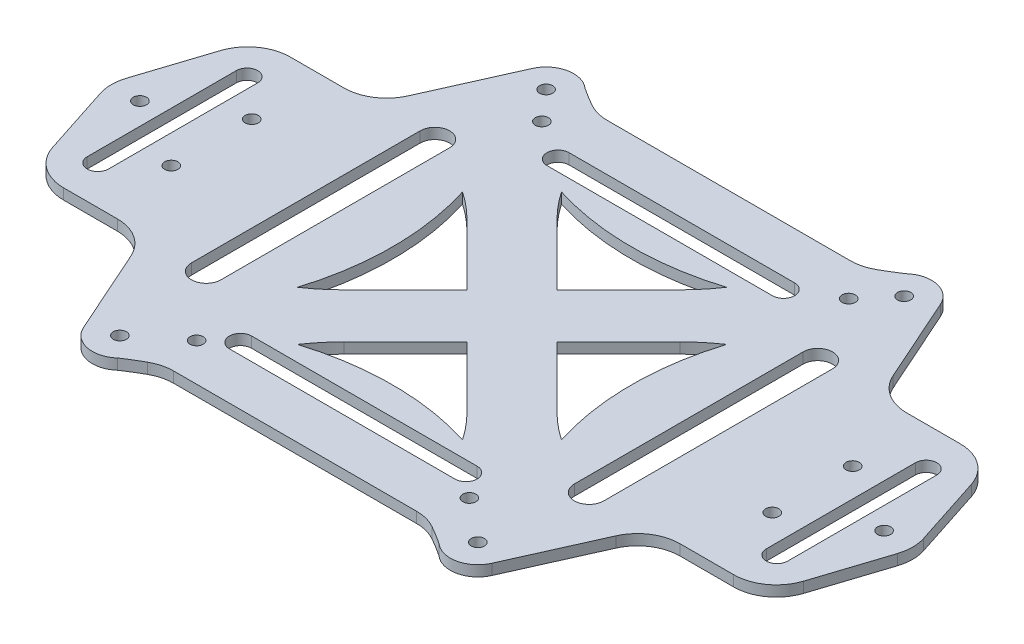
from build123d import *

# Parameters (mm, degrees)
SKETCH_1_R      = 1.55
EXTRUDE_1_DEPTH = 2.5
FILLET_1_R      = 10


with BuildPart() as part:
    # 草图1 → 凸台-拉伸1 (new body)
    with BuildSketch(Plane(origin=(0, 0, 0), x_dir=(1, 0, 0), z_dir=(0, 1, 0))):
        with BuildLine():
            Line((47.899982554, 52.633397656), (59.52497064, 26.588251477))
            Line((59.52497064, 26.588251477), (85.869588061, 26.588251477))
            Line((85.869588061, 26.588251477), (94.505759306, 0))
            Line((94.505759306, 0), (85.869588061, -26.588251477))
            Line((85.869588061, -26.588251477), (59.52497064, -26.588251477))
            Line((59.52497064, -26.588251477), (47.899982554, -52.633397656))
            ThreePointArc((47.899982554, -52.633397656), (43.362068791, -56.315801292), (37.709796983, -54.831018053))
            ThreePointArc((37.709796983, -54.831018053), (34.400449937, -52.764318952), (30.978168019, -50.89055015))
            Line((30.978168019, -50.89055015), (-30.978168019, -50.89055015))
            ThreePointArc((-30.978168019, -50.89055015), (-34.400449937, -52.764318952), (-37.709796983, -54.831018053))
            ThreePointArc((-37.709796983, -54.831018053), (-43.362068791, -56.315801292), (-47.899982554, -52.633397656))
            Line((-47.899982554, -52.633397656), (-59.52497064, -26.588251477))
            Line((-59.52497064, -26.588251477), (-85.869588061, -26.588251477))
            Line((-85.869588061, -26.588251477), (-94.505759306, 0))
            Line((-94.505759306, 0), (-85.869588061, 26.588251477))
            Line((-85.869588061, 26.588251477), (-59.52497064, 26.588251477))
            Line((-59.52497064, 26.588251477), (-47.899982554, 52.633397656))
            ThreePointArc((-47.899982554, 52.633397656), (-43.362068791, 56.315801292), (-37.709796983, 54.831018053))
            ThreePointArc((-37.709796983, 54.831018053), (-34.400449937, 52.764318952), (-30.978168019, 50.89055015))
            Line((-30.978168019, 50.89055015), (30.978168019, 50.89055015))
            ThreePointArc((30.978168019, 50.89055015), (34.400449937, 52.764318952), (37.709796983, 54.831018053))
            ThreePointArc((37.709796983, 54.831018053), (43.362068791, 56.315801292), (47.899982554, 52.633397656))
        make_face()
        with Locations((42, 50)):
            Circle(SKETCH_1_R, mode=Mode.SUBTRACT)
        with Locations((42, -50)):
            Circle(SKETCH_1_R, mode=Mode.SUBTRACT)
        with Locations((-42, -50)):
            Circle(SKETCH_1_R, mode=Mode.SUBTRACT)
        with Locations((-42, 50)):
            Circle(SKETCH_1_R, mode=Mode.SUBTRACT)
        with Locations((36, 43)):
            Circle(SKETCH_1_R, mode=Mode.SUBTRACT)
        with Locations((32, -42)):
            Circle(SKETCH_1_R, mode=Mode.SUBTRACT)
        with Locations((-32, -42)):
            Circle(SKETCH_1_R, mode=Mode.SUBTRACT)
        with Locations((-36, 43)):
            Circle(SKETCH_1_R, mode=Mode.SUBTRACT)
        with Locations((70.5, 9.435839055)):
            Circle(SKETCH_1_R, mode=Mode.SUBTRACT)
        with Locations((70.5, -9.435839055)):
            Circle(SKETCH_1_R, mode=Mode.SUBTRACT)
        with Locations((-70.5, -9.435839055)):
            Circle(SKETCH_1_R, mode=Mode.SUBTRACT)
        with Locations((-70.5, 9.435839055)):
            Circle(SKETCH_1_R, mode=Mode.SUBTRACT)
        with Locations((87.3, 0)):
            Circle(SKETCH_1_R, mode=Mode.SUBTRACT)
        with Locations((-87.3, 0)):
            Circle(SKETCH_1_R, mode=Mode.SUBTRACT)
        with BuildLine():
            Line((77.169642998, -17.5), (77.169642998, 17.5))
            ThreePointArc((77.169642998, 17.5), (79.669642998, 20), (82.169642998, 17.5))
            Line((82.169642998, 17.5), (82.169642998, -17.5))
            ThreePointArc((82.169642998, -17.5), (79.669642998, -20), (77.169642998, -17.5))
        make_face(mode=Mode.SUBTRACT)
        with BuildLine():
            Line((-77.169642998, -17.5), (-77.169642998, 17.5))
            ThreePointArc((-77.169642998, 17.5), (-79.669642998, 20), (-82.169642998, 17.5))
            Line((-82.169642998, 17.5), (-82.169642998, -17.5))
            ThreePointArc((-82.169642998, -17.5), (-79.669642998, -20), (-77.169642998, -17.5))
        make_face(mode=Mode.SUBTRACT)
        with BuildLine():
            Line((-24.995975583, 14.429581723), (-10.56639386, 0))
            Line((-10.56639386, 0), (-24.995975583, -14.429581723))
            ThreePointArc((-24.995975583, -14.429581723), (-27.869597938, -17.042325553), (-30.978168019, -19.370614155))
            ThreePointArc((-30.978168019, -19.370614155), (-28.024295248, 0), (-30.978168019, 19.370614155))
            ThreePointArc((-30.978168019, 19.370614155), (-27.869597938, 17.042325553), (-24.995975583, 14.429581723))
        make_face(mode=Mode.SUBTRACT)
        with BuildLine():
            Line((14.429581723, 24.995975583), (0, 10.56639386))
            Line((0, 10.56639386), (-14.429581723, 24.995975583))
            ThreePointArc((-14.429581723, 24.995975583), (-17.042325553, 27.869597938), (-19.370614155, 30.978168019))
            ThreePointArc((-19.370614155, 30.978168019), (0, 28.024295248), (19.370614155, 30.978168019))
            ThreePointArc((19.370614155, 30.978168019), (17.042325553, 27.869597938), (14.429581723, 24.995975583))
        make_face(mode=Mode.SUBTRACT)
        with BuildLine():
            Line((24.995975583, -14.429581723), (10.56639386, 0))
            Line((10.56639386, 0), (24.995975583, 14.429581723))
            ThreePointArc((24.995975583, 14.429581723), (27.869597938, 17.042325553), (30.978168019, 19.370614155))
            ThreePointArc((30.978168019, 19.370614155), (28.024295248, 0), (30.978168019, -19.370614155))
            ThreePointArc((30.978168019, -19.370614155), (27.869597938, -17.042325553), (24.995975583, -14.429581723))
        make_face(mode=Mode.SUBTRACT)
        with BuildLine():
            Line((-14.429581723, -24.995975583), (0, -10.56639386))
            Line((0, -10.56639386), (14.429581723, -24.995975583))
            ThreePointArc((14.429581723, -24.995975583), (17.042325553, -27.869597938), (19.370614155, -30.978168019))
            ThreePointArc((19.370614155, -30.978168019), (0, -28.024295248), (-19.370614155, -30.978168019))
            ThreePointArc((-19.370614155, -30.978168019), (-17.042325553, -27.869597938), (-14.429581723, -24.995975583))
        make_face(mode=Mode.SUBTRACT)
        with BuildLine():
            Line((41.468701347, -26.829343455), (41.468701347, 26.829343455))
            ThreePointArc((41.468701347, 26.829343455), (44.919200659, 30.279842767), (48.36969997, 26.829343455))
            Line((48.36969997, 26.829343455), (48.36969997, -26.829343455))
            ThreePointArc((48.36969997, -26.829343455), (44.919200659, -30.279842767), (41.468701347, -26.829343455))
        make_face(mode=Mode.SUBTRACT)
        with BuildLine():
            Line((-26.453510137, -34.636976429), (26.453510137, -34.636976429))
            ThreePointArc((26.453510137, -34.636976429), (29.060662927, -37.244129219), (26.453510137, -39.851282009))
            Line((26.453510137, -39.851282009), (-26.453510137, -39.851282009))
            ThreePointArc((-26.453510137, -39.851282009), (-29.060662927, -37.244129219), (-26.453510137, -34.636976429))
        make_face(mode=Mode.SUBTRACT)
        with BuildLine():
            Line((-26.453510137, 34.636976429), (26.453510137, 34.636976429))
            ThreePointArc((26.453510137, 34.636976429), (29.060662927, 37.244129219), (26.453510137, 39.851282009))
            Line((26.453510137, 39.851282009), (-26.453510137, 39.851282009))
            ThreePointArc((-26.453510137, 39.851282009), (-29.060662927, 37.244129219), (-26.453510137, 34.636976429))
        make_face(mode=Mode.SUBTRACT)
        with BuildLine():
            Line((-41.468701347, -26.829343455), (-41.468701347, 26.829343455))
            ThreePointArc((-41.468701347, 26.829343455), (-44.919200659, 30.279842767), (-48.36969997, 26.829343455))
            Line((-48.36969997, 26.829343455), (-48.36969997, -26.829343455))
            ThreePointArc((-48.36969997, -26.829343455), (-44.919200659, -30.279842767), (-41.468701347, -26.829343455))
        make_face(mode=Mode.SUBTRACT)
    extrude(amount=EXTRUDE_1_DEPTH)

    # 圆角1
    fillet_1_edges = [part.edges().sort_by_distance(p)[0] for p in [
        (59.52497064, 1.25, -26.588251477),
        (85.869588061, 1.25, -26.588251477),
        (85.869588061, 1.25, 26.588251477),
        (94.505759306, 1.25, 0),
        (59.52497064, 1.25, 26.588251477),
        (-59.52497064, 1.25, 26.588251477),
        (-59.52497064, 1.25, -26.588251477),
        (-85.869588061, 1.25, -26.588251477),
        (-85.869588061, 1.25, 26.588251477),
        (-94.505759306, 1.25, 0),
        (30.978168019, 1.25, -50.89055015),
        (-30.978168019, 1.25, -50.89055015),
        (30.978168019, 1.25, 50.89055015),
        (-30.978168019, 1.25, 50.89055015),
    ]]
    fillet(fillet_1_edges, radius=FILLET_1_R)


solid = part.part
